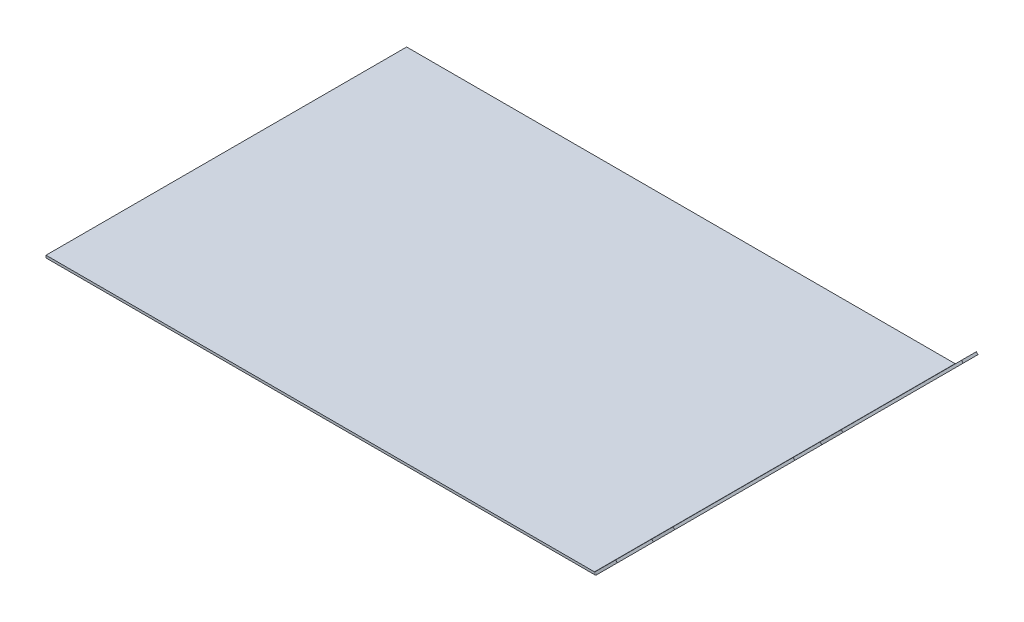
from build123d import *

# Parameters (mm, degrees)
ESBO_O1_W               = 506.849315068
ESBO_O1_H               = 300
FLANGE_BASE1_DEPTH      = 2
DOBRA_START             = -150
DOBRA_ESBO_ADA1_DEPTH   = 300
DOBRA_ESBO_ADA1_2_DEPTH = 300
ESBO_O7_W               = 25
ESBO_O7_H               = 30
ESBO_O7_H_2             = 40
CORTE_EXTRUS_O1_DEPTH   = 409.841691807


# Read off the part's stored shape, not the designer's step: Dobra esboçada1
# Sheet-metal steps are written as plain solids
with BuildPart() as part:
    # Esboço1 → Flange-base1 (new body)
    with BuildSketch(Plane(origin=(0, 0, 0), x_dir=(1, 0, 0), z_dir=(0, 1, 0))):
        Rectangle(ESBO_O1_W, ESBO_O1_H)
    extrude(amount=-FLANGE_BASE1_DEPTH)

    # Dobra esboçada1 outline → Dobra esboçada1 (cut)
    with BuildSketch(Plane.XY.offset(DOBRA_START)):
        with BuildLine():
            Line((253.424657534, 0), (205.876233143, 0))
            Line((205.876233143, 0), (204.677764726, -1.198468417))
            ThreePointArc((204.677764726, -1.198468417), (203.78994779, -1.791688729), (202.742696309, -2))
            Line((202.742696309, -2), (253.424657534, -2))
            Line((253.424657534, -2), (253.424657534, 0))
        make_face()
    extrude(amount=DOBRA_ESBO_ADA1_DEPTH, mode=Mode.SUBTRACT)

    # Dobra esbo_ada1 2 outline → Dobra esbo_ada1 2 (add)
    with BuildSketch(Plane.XY.offset(DOBRA_START)):
        with BuildLine():
            Line((238.136670816, 35.088864797), (203.263551164, 0.215745145))
            ThreePointArc((203.263551164, 0.215745145), (203.024580925, 0.056070336), (202.742696309, 0))
            Line((202.742696309, 0), (205.876233143, 0))
            Line((205.876233143, 0), (239.550884379, 33.674651235))
            Line((239.550884379, 33.674651235), (238.136670816, 35.088864797))
        make_face()
    extrude(amount=DOBRA_ESBO_ADA1_2_DEPTH)

    # Esboço7 → Corte-extrusão1 (cut, through all)
    with BuildSketch(Plane(origin=(101.52390301, -101.52390301, 0), x_dir=(0.7071067811865464, 0.7071067811865488, 0), z_dir=(-0.7071067811865488, 0.7071067811865464, 0))):
        with Locations((180.699629026, 135)):
            Rectangle(ESBO_O7_W, ESBO_O7_H)
        with Locations((180.699629026, 0)):
            Rectangle(ESBO_O7_W, ESBO_O7_H_2)
        with Locations((180.699629026, -135)):
            Rectangle(ESBO_O7_W, ESBO_O7_H)
    extrude(amount=-CORTE_EXTRUS_O1_DEPTH, mode=Mode.SUBTRACT)


solid = part.part
